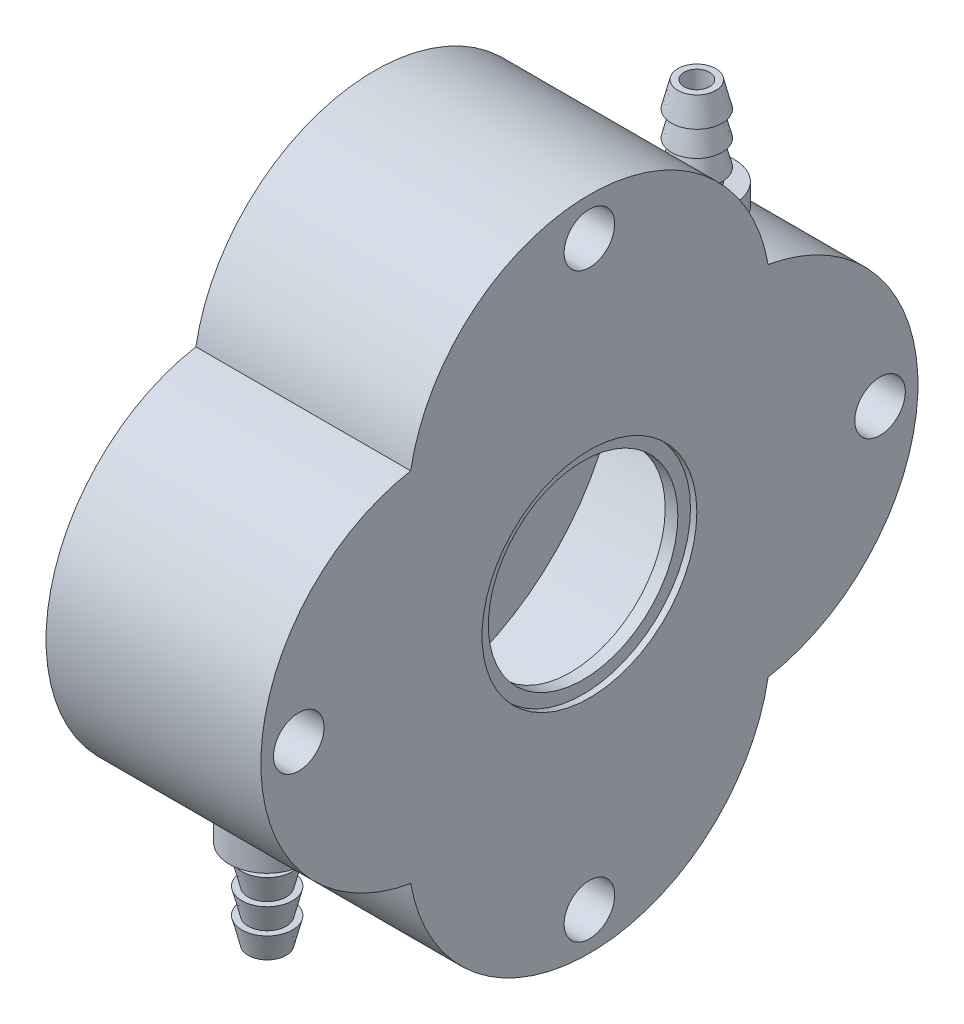
from build123d import *

# Parameters (mm, degrees)
SKETCH2_R           = 2
FLANGE_DEPTH        = 8.5
SKETCH10_R          = 7.5
CUT_EXTRUDE2_DEPTH  = 10
SKETCH3_R           = 8.5
O_RING_SEAT_DEPTH   = 0.5
SKETCH8_R           = 18
CUT_EXTRUDE1_DEPTH  = 7
SKETCH5_R           = 1
OUTLET_DEPTH        = 38.739236876
BOSS_EXTRUDE2_REACH = 50.576
SKETCH6_R           = 3
SKETCH6_R_2         = 1
INLET_COUNT         = 2
SKETCH11_W          = 10.606601718
SKETCH11_H          = 10.606601718
CUT_EXTRUDE3_DEPTH  = 0.5
SKETCH12_R          = 0.5
CUT_EXTRUDE4_DEPTH  = 41.099875416
CHAMFER1_SIZE       = 1


with BuildPart() as part:
    # Sketch2 → Flange (new, symmetric)
    with BuildSketch(Plane(origin=(0, 0, 0), x_dir=(0, 0, -1), z_dir=(1, 0, 0))):
        with BuildLine():
            ThreePointArc((-14.142135624, 14.142135624), (-26, 0), (-14.142135624, -14.142135624))
            ThreePointArc((-14.142135624, -14.142135624), (0, -26), (14.142135624, -14.142135624))
            ThreePointArc((14.142135624, -14.142135624), (26, 0), (14.142135624, 14.142135624))
            ThreePointArc((14.142135624, 14.142135624), (0, 26), (-14.142135624, 14.142135624))
        make_face()
        with Locations((0, 23)):
            Circle(SKETCH2_R, mode=Mode.SUBTRACT)
        with Locations((23, 0)):
            Circle(SKETCH2_R, mode=Mode.SUBTRACT)
        with Locations((0, -23)):
            Circle(SKETCH2_R, mode=Mode.SUBTRACT)
        with Locations((-23, 0)):
            Circle(SKETCH2_R, mode=Mode.SUBTRACT)
    extrude(amount=FLANGE_DEPTH, both=True)

    # Sketch10 → Cut-Extrude2 (cut)
    with BuildSketch(Plane(origin=(8.5, 0, 0), x_dir=(0, 0, -1), z_dir=(1, 0, 0))):
        Circle(SKETCH10_R)
    extrude(amount=-CUT_EXTRUDE2_DEPTH, mode=Mode.SUBTRACT)

    # Sketch3 → O-Ring Seat (cut)
    with BuildSketch(Plane(origin=(8.5, 0, 0), x_dir=(0, 0, -1), z_dir=(1, 0, 0))):
        Circle(SKETCH3_R)
    extrude(amount=-O_RING_SEAT_DEPTH, mode=Mode.SUBTRACT)

    # Sketch8 → Cut-Extrude1 (cut, symmetric)
    with BuildSketch(Plane.ZY):
        Circle(SKETCH8_R)
    extrude(amount=CUT_EXTRUDE1_DEPTH, both=True, mode=Mode.SUBTRACT)

    # Sketch5 → Outlet (cut, through all)
    with BuildSketch(Plane(origin=(0, 0, 0), x_dir=(1, 0, 0), z_dir=(0, 1, 0))):
        with Locations(Location((0, 17, 0), (0, 0, 90))):
            Circle(SKETCH5_R)
    outlet = extrude(amount=OUTLET_DEPTH, mode=Mode.SUBTRACT)

    # Sketch6 → Boss-Extrude2 (add, up to next)
    with BuildSketch(Plane(origin=(0, 14.142135624, 0), x_dir=(1, 0, 0), z_dir=(0, 1, 0)), mode=Mode.PRIVATE) as boss_extrude2_sk1:
        with Locations((0, 17)):
            Circle(SKETCH6_R)
        with Locations(Location((0, 17, 0), (0, 0, 90))):
            Circle(SKETCH6_R_2, mode=Mode.SUBTRACT)
    boss_extrude2_tool1 = extrude(boss_extrude2_sk1.sketch, amount=-BOSS_EXTRUDE2_REACH, mode=Mode.PRIVATE) - part.part
    boss_extrude2 = boss_extrude2_tool1.solids().sort_by_distance((-2.915147, 14.142136, -17))[0]
    add(boss_extrude2)

    # Sketch9 → Revolve1 (revolve)
    with BuildSketch(Plane(origin=(0, 0, 0), x_dir=(0, 0, -1), z_dir=(1, 0, 0)), mode=Mode.PRIVATE) as revolve1_sk:
        Polygon((18, 14.142135624), (18, 21.142135624), (18.5, 21.142135624), (19, 19.142135624), (18.5, 19.142135624), (19, 17.142135624), (18.5, 17.142135624), (19, 15.142135624), (18.5, 15.142135624), (18.5, 14.142135624), align=None)
    revolve1 = revolve(revolve1_sk.sketch.rotate(Axis((0, 14.142135624, -17), (0, -1, 0)), 180), axis=Axis((0, 14.142135624, -17), (0, -1, 0)))

    # Inlet: Outlet, Boss-Extrude2, Revolve1 ×2 about axis
    inlet_axis = Axis((8, 0, 0), (1, 0, 0))
    add([outlet.rotate(inlet_axis, i * 360 / INLET_COUNT) for i in range(1, INLET_COUNT)], mode=Mode.SUBTRACT)
    add([boss_extrude2.rotate(inlet_axis, i * 360 / INLET_COUNT) for i in range(1, INLET_COUNT)])
    add([revolve1.rotate(inlet_axis, i * 360 / INLET_COUNT) for i in range(1, INLET_COUNT)])

    # Sketch11 → Cut-Extrude3 (cut)
    with BuildSketch(Plane(origin=(-7, 0, 0), x_dir=(0, 0, -1), z_dir=(1, 0, 0))):
        Rectangle(SKETCH11_W, SKETCH11_H)
    extrude(amount=-CUT_EXTRUDE3_DEPTH, mode=Mode.SUBTRACT)

    # Sketch12 → Cut-Extrude4 (cut, through all)
    with BuildSketch(Plane(origin=(-7.5, 0, 0), x_dir=(0, 0, -1), z_dir=(1, 0, 0))):
        with Locations((4.803300859, 4.803300859)):
            Circle(SKETCH12_R)
        with Locations((-4.803300859, -4.803300859)):
            Circle(SKETCH12_R)
    extrude(amount=-CUT_EXTRUDE4_DEPTH, mode=Mode.SUBTRACT)

    # Chamfer1
    chamfer1_edges = [part.edges().sort_by_distance(p)[0] for p in [
        (-8.5, 4.803300859, -4.303300859),
        (-8.5, -4.803300859, 5.303300859),
    ]]
    chamfer(chamfer1_edges, length=CHAMFER1_SIZE - 0.0001)  # a hair under: the kernel refuses the full size


solid = part.part
